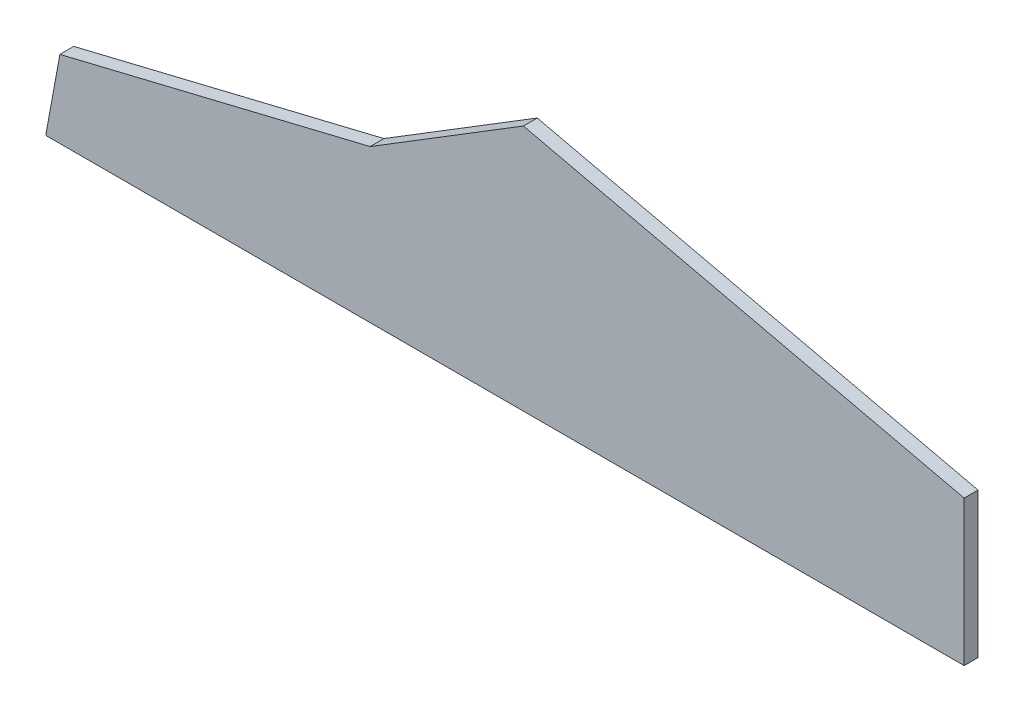
from build123d import *

# Parameters (mm, degrees)
BOSS_EXTRUDE1_DEPTH = 4.7625


with BuildPart() as part:
    # Sketch2 → Boss-Extrude1 (new, symmetric)
    with BuildSketch(Plane.XY):
        Polygon((-318.797397456, 52.106011358), (-105.437397456, 103.886), (0, 168.8465), (303.09188556, 98.800000012), (303.09188556, 0), (303.09188556, -1), (-328.331514278, -1), (-328.331514278, 0), align=None)
    extrude(amount=BOSS_EXTRUDE1_DEPTH, both=True)


solid = part.part
